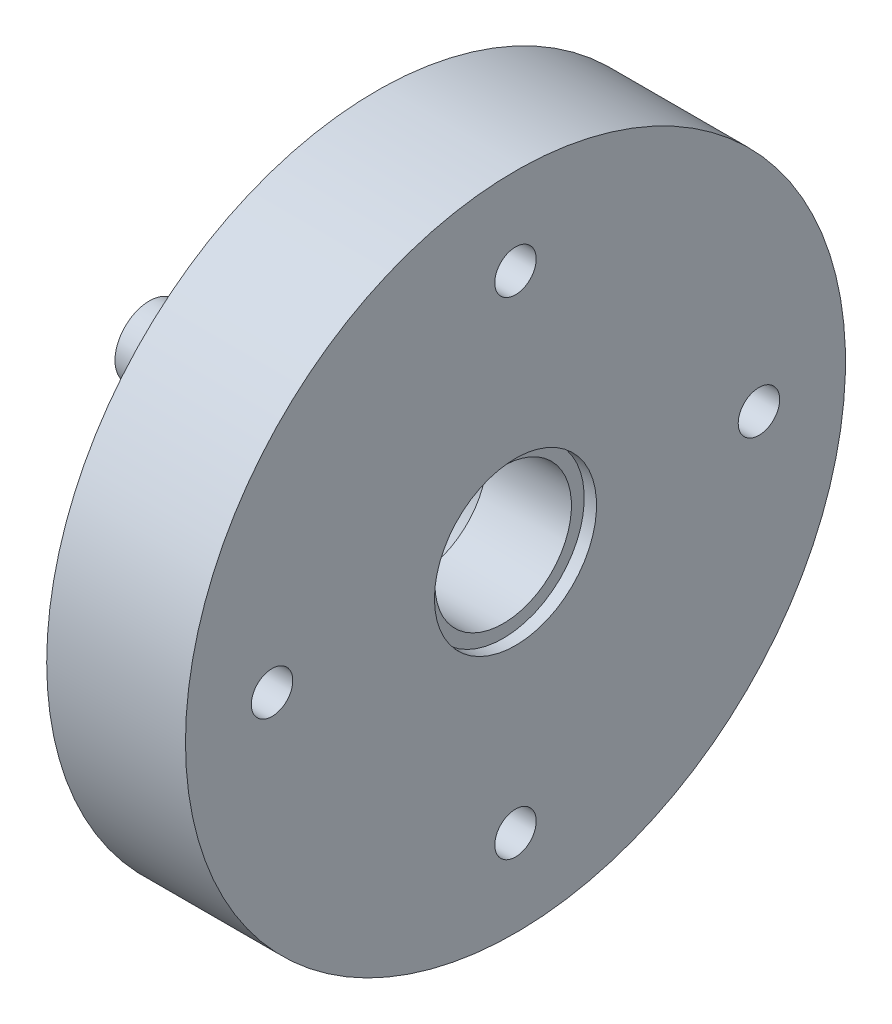
from build123d import *

# Parameters (mm, degrees)
CBORE_FOR_M3_HEX_SOCKET_HEAD_CAP_SCR_2_COUNT = 2
CBORE_FOR_M3_HEX_SOCKET_HEAD_CAP_SCR_2_PITCH = 28.243387552
CBORE_FOR_M3_HEX_SOCKET_HEAD_CAP_SCR_3_COUNT = 2
CBORE_FOR_M3_HEX_SOCKET_HEAD_CAP_SCR_3_PITCH = 39.942181723
CBORE_FOR_M3_HEX_SOCKET_HEAD_CAP_SCR_4_COUNT = 2
CBORE_FOR_M3_HEX_SOCKET_HEAD_CAP_SCR_4_PITCH = 28.243387552


with BuildPart() as part:
    # Sketch1 → Revolve17 (revolve)
    with BuildSketch(Plane.XY):
        Polygon((-71.291859268, 14.884170222), (-71.291859268, 14.534170222), (-66.841859268, 14.884170222), (-66.841859268, 14.534170222), (-62.371609448, 14.884170222), (-62.371609448, 14.534170222), (-59.488918076, 23.788045652), (-57.091214807, 23.788045652), (-57.091214807, 38.788045652), (-45.705811648, 38.788045652), (-45.705811648, 19.977485582), (-45.705811648, 18.364170222), (-46.715811648, 18.364170222), (-46.715811648, 17.314170222), (-53.637545484, 17.314170222), (-59.488918076, 13.399170222), (-75.741859268, 13.399170222), (-75.741859268, 14.534170222), align=None)
    revolve(axis=Axis((-795.163849313, 11.714170222, 0), (1, 0, 0)))

    # Sketch4 → CBORE for M3 Hex Socket Head Cap Screw1 (revolve, cut)
    with BuildSketch(Plane(origin=(-57.091214807, 11.714170222, -19.971090862), x_dir=(0, 0, 1), z_dir=(0, 1, 0))):
        Polygon((0, 0), (0, 11.385403159), (1.7, 11.385403159), (1.7, 3.4), (3.25, 3.4), (3.25, 0.025), (3.275, 0), align=None)
    cbore_for_m3_hex_socket_head_cap_screw1 = revolve(axis=Axis((-63.441214807, 11.714170222, -19.971090862), (1, 0, 0)), mode=Mode.SUBTRACT)

    # CBORE for M3 Hex Socket Head Cap Scr 2: CBORE for M3 Hex Socket Head Cap Screw1 ×2
    with Locations(*[Vector(0, 0.7071067811865475, 0.7071067811865476) * (i * CBORE_FOR_M3_HEX_SOCKET_HEAD_CAP_SCR_2_PITCH) for i in range(1, CBORE_FOR_M3_HEX_SOCKET_HEAD_CAP_SCR_2_COUNT)]):
        add(cbore_for_m3_hex_socket_head_cap_screw1, mode=Mode.SUBTRACT)

    # CBORE for M3 Hex Socket Head Cap Scr 3: CBORE for M3 Hex Socket Head Cap Screw1 ×2
    with Locations(*[(0, 0, i * CBORE_FOR_M3_HEX_SOCKET_HEAD_CAP_SCR_3_PITCH) for i in range(1, CBORE_FOR_M3_HEX_SOCKET_HEAD_CAP_SCR_3_COUNT)]):
        add(cbore_for_m3_hex_socket_head_cap_screw1, mode=Mode.SUBTRACT)

    # CBORE for M3 Hex Socket Head Cap Scr 4: CBORE for M3 Hex Socket Head Cap Screw1 ×2
    with Locations(*[Vector(0, -0.7071067811865476, 0.7071067811865475) * (i * CBORE_FOR_M3_HEX_SOCKET_HEAD_CAP_SCR_4_PITCH) for i in range(1, CBORE_FOR_M3_HEX_SOCKET_HEAD_CAP_SCR_4_COUNT)]):
        add(cbore_for_m3_hex_socket_head_cap_screw1, mode=Mode.SUBTRACT)


solid = part.part
